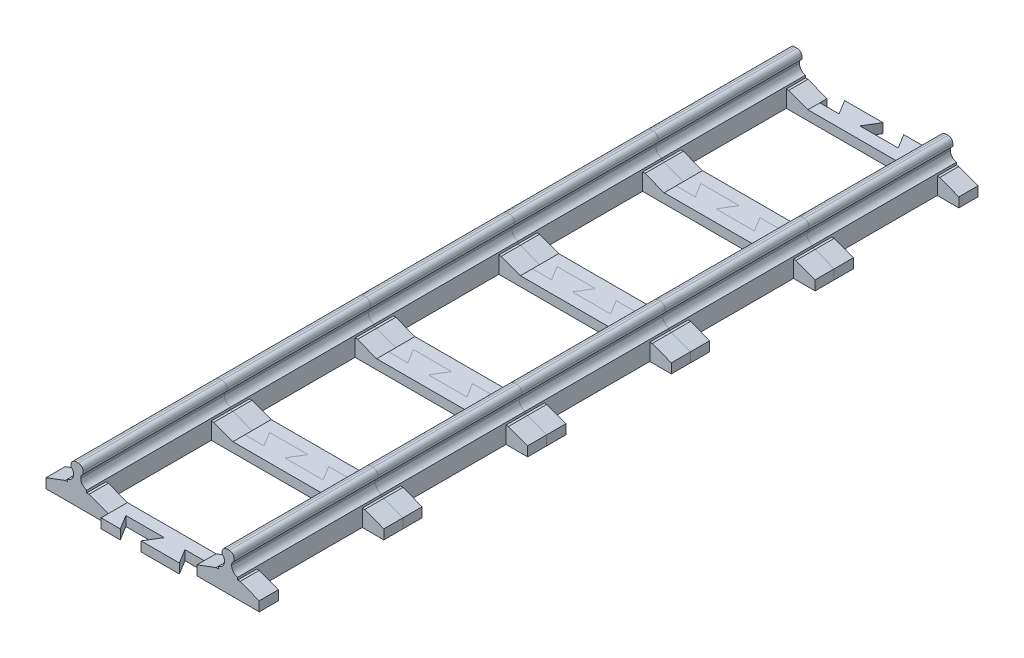
from build123d import *

# Parameters (mm, degrees)
SKETCH_1_W               = 4
SKETCH_1_H               = 11
SKETCH_1_H_2             = 8
EXTRUDE_1_DEPTH          = 4
SKETCH_1_7_W             = 44.5
SKETCH_1_7_H             = 8
EXTRUDE_2_DEPTH          = 3.5
SKETCH_2_W               = 18.5
SKETCH_2_H               = 1.5
CUT_EXTRUDE_1_DEPTH      = 30.53070436
SKETCH_2_3_W             = 2.5
SKETCH_2_3_H             = 1.5
EXTRUDE_4_DEPTH          = 19
FILLET_1_R               = 1
FILLET_2_R               = 1.5
FILLET_3_R               = 1
CUT_EXTRUDE_2_DEPTH      = 37.65122781
CUT_EXTRUDE_2_DEPTH_BACK = 37.65122781
PATTERN_LINEAR_1_COUNT   = 5
PATTERN_LINEAR_1_PITCH   = 30


with BuildPart() as part:
    # 草图1 → 凸台-拉伸1 (new body)
    with BuildSketch(Plane(origin=(0, 0, 0), x_dir=(1, 0, 0), z_dir=(0, 1, 0))):
        with Locations((-15.75, -4)):
            Rectangle(SKETCH_1_W, SKETCH_1_H)
        with Locations((15.75, -4)):
            Rectangle(SKETCH_1_W, SKETCH_1_H)
        with Locations((15.75, 5.5)):
            Rectangle(SKETCH_1_W, SKETCH_1_H_2)
        with Locations((-15.75, 5.5)):
            Rectangle(SKETCH_1_W, SKETCH_1_H_2)
    extrude(amount=EXTRUDE_1_DEPTH)

    # 草图1<7> → 凸台-拉伸2 (add)
    with BuildSketch(Plane(origin=(0, 0, 0), x_dir=(1, 0, 0), z_dir=(0, 1, 0))):
        with Locations((0, 5.5)):
            Rectangle(SKETCH_1_7_W, SKETCH_1_7_H)
    extrude(amount=EXTRUDE_2_DEPTH)

    # 草图2 → 切除-拉伸1 (cut, through all)
    with BuildSketch(Plane(origin=(0, 0, -9.5), x_dir=(-1, 0, 0), z_dir=(0, 0, -1))):
        with Locations((0, 2.75)):
            Rectangle(SKETCH_2_W, SKETCH_2_H)
        Polygon((13.25, 3.5), (9.25, 3.5), (9.25, 2), align=None)
        Polygon((-9.25, 3.5), (-13.25, 3.5), (-9.25, 2), align=None)
        Polygon((-22.25, 3.5), (-22.25, 2), (-18.25, 3.5), align=None)
        Polygon((22.25, 3.5), (18.25, 3.5), (22.25, 2), align=None)
    extrude(amount=-CUT_EXTRUDE_1_DEPTH, mode=Mode.SUBTRACT)

    # 草图2<3> → 凸台-拉伸4 (add, through all)
    with BuildSketch(Plane(origin=(0, 0, -9.5), x_dir=(-1, 0, 0), z_dir=(0, 0, -1))):
        with Locations((-15.75, 7.25)):
            Rectangle(SKETCH_2_3_W, SKETCH_2_3_H)
        Polygon((-15, 6.5), (-16.5, 6.5), (-16.5, 4), (-15.75, 4), (-15, 4), align=None)
        with Locations((15.75, 7.25)):
            Rectangle(SKETCH_2_3_W, SKETCH_2_3_H)
        Polygon((16.5, 6.5), (15, 6.5), (15, 4), (15.75, 4), (16.5, 4), align=None)
    extrude(amount=-EXTRUDE_4_DEPTH)

    # 圆角1
    # the kernel refuses this fillet: 1 mm, written as the material it adds along each edge
    with BuildSketch(Plane(origin=(-16.5, 6.5, -9.5), x_dir=(0, -1, 0), z_dir=(0, 0, 1))) as fillet_1_piece_1:
        with BuildLine():
            CenterArc((0.866025404, -1), FILLET_1_R, 90, 60)
            Line((0, -0.5), (-0.017320508, -0.49))
            ThreePointArc((-0.017320508, -0.49), (-0.02, -0.25), (-0.02, 0))
            Line((-0.02, 0), (0, 0.02))
            Line((0, 0.02), (0.866025404, 0.02))
            Line((0.866025404, 0.02), (0.866025404, 0))
        make_face()
    extrude(amount=19)
    with BuildSketch(Plane(origin=(-15, 6.5, -9.5), x_dir=(0, -1, 0), z_dir=(0, 0, 1)), Plane(origin=(16.5, 6.5, -9.5), x_dir=(0, -1, 0), z_dir=(0, 0, 1))) as fillet_1_piece_2:
        with BuildLine():
            CenterArc((0.866025404, 1), FILLET_1_R, 210, 60)
            Line((0, 0.5), (-0.017320508, 0.49))
            ThreePointArc((-0.017320508, 0.49), (-0.02, 0.25), (-0.02, 0))
            Line((-0.02, 0), (0, -0.02))
            Line((0, -0.02), (0.866025404, -0.02))
            Line((0.866025404, -0.02), (0.866025404, 0))
        make_face()
    extrude(amount=19)
    with BuildSketch(Plane(origin=(15, 6.5, -9.5), x_dir=(-1, 0, 0), z_dir=(0, 0, 1))) as fillet_1_piece_3:
        with BuildLine():
            CenterArc((1, 0.866025404), FILLET_1_R, 180, 60)
            Line((0, 0.866025404), (-0.02, 0.866025404))
            Line((-0.02, 0.866025404), (-0.02, 0))
            Line((-0.02, 0), (0, -0.02))
            ThreePointArc((0, -0.02), (0.25, -0.02), (0.49, -0.017320508))
            Line((0.49, -0.017320508), (0.5, 0))
        make_face()
    extrude(amount=19)

    # 圆角2
    # the kernel refuses this fillet: 1.5 mm, written as the material it adds along each edge
    with BuildSketch(Plane(origin=(16.5, 4, -9.5), x_dir=(1, 0, 0), z_dir=(0, 0, 1)), Plane(origin=(-15, 4, -9.5), x_dir=(1, 0, 0), z_dir=(0, 0, 1))) as fillet_2_piece_1:
        with BuildLine():
            CenterArc((1.5, 1.479019946), FILLET_2_R, 180, 80.405931773)
            Line((0, 1.479019946), (-0.03, 1.479019946))
            Line((-0.03, 1.479019946), (-0.03, 0))
            Line((-0.03, 0), (0, -0.03))
            ThreePointArc((0, -0.03), (0.625, -0.03), (1.245, -0.029580399))
            Line((1.245, -0.029580399), (1.25, 0))
        make_face()
    extrude(amount=19)
    with BuildSketch(Plane(origin=(15, 4, -9.5), x_dir=(0, 1, 0), z_dir=(0, 0, 1)), Plane(origin=(-16.5, 4, -9.5), x_dir=(0, 1, 0), z_dir=(0, 0, 1))) as fillet_2_piece_2:
        with BuildLine():
            CenterArc((1.479019946, 1.5), FILLET_2_R, 189.594068227, 80.405931773)
            Line((0, 1.25), (-0.029580399, 1.245))
            ThreePointArc((-0.029580399, 1.245), (-0.03, 0.625), (-0.03, 0))
            Line((-0.03, 0), (0, -0.03))
            Line((0, -0.03), (1.479019946, -0.03))
            Line((1.479019946, -0.03), (1.479019946, 0))
        make_face()
    extrude(amount=19)

    # 圆角3
    fillet_3_edges = [part.edges().sort_by_distance(p)[0] for p in [
        (14.5, 8, 0),
        (17, 8, 0),
        (-17, 8, 0),
        (-14.5, 8, 0),
    ]]
    fillet(fillet_3_edges, radius=FILLET_3_R)

    # 镜向2: part across plane


with BuildPart() as part_1:
    add(part.part)
    add(part.part.mirror(Plane(origin=(0, 4, 9.5), x_dir=(1, 0, 0), z_dir=(0, 0, -1))))

    # 草图9 → 切除-拉伸2 (cut, two sides: drawn at the far end of the back side and taken through both)
    with BuildSketch(Plane(origin=(0, 2, 0), x_dir=(1, 0, 0), z_dir=(0, 1, 0)).offset(-CUT_EXTRUDE_2_DEPTH_BACK)):
        Polygon((-22.25, 5.5), (-9.25, 5.5), (-9.25, 4), (-5.25, 4), (-7.083333333, 7), (0.916666667, 7), (-0.916666667, 4), (7.083333333, 4), (5.25, 7), (9.25, 7), (9.25, 5.5), (22.25, 5.5), (22.25, 9.5), (-22.25, 9.5), align=None)
        Polygon((-22.25, -24.5), (-9.25, -24.5), (-9.25, -26), (-5.25, -26), (-7.083333333, -23), (0.916666667, -23), (-0.916666667, -26), (7.083333333, -26), (5.25, -23), (9.25, -23), (9.25, -24.5), (22.25, -24.5), (22.25, -28.5), (-22.25, -28.5), align=None)
    extrude(amount=CUT_EXTRUDE_2_DEPTH + CUT_EXTRUDE_2_DEPTH_BACK, mode=Mode.SUBTRACT)


with BuildPart() as pattern_linear_1_1:
    # 阵列(线性)1: pattern copy
    add(part_1.part.moved(Location(Vector(0, 0, -1) * (1 * PATTERN_LINEAR_1_PITCH))))


with BuildPart() as pattern_linear_1_2:
    # 阵列(线性)1: pattern copy
    add(part_1.part.moved(Location(Vector(0, 0, -1) * (2 * PATTERN_LINEAR_1_PITCH))))


with BuildPart() as pattern_linear_1_3:
    # 阵列(线性)1: pattern copy
    add(part_1.part.moved(Location(Vector(0, 0, -1) * (3 * PATTERN_LINEAR_1_PITCH))))


with BuildPart() as pattern_linear_1_4:
    # 阵列(线性)1: pattern copy
    add(part_1.part.moved(Location(Vector(0, 0, -1) * (4 * PATTERN_LINEAR_1_PITCH))))


solid = Compound([part_1.part, pattern_linear_1_1.part, pattern_linear_1_2.part, pattern_linear_1_3.part, pattern_linear_1_4.part])
